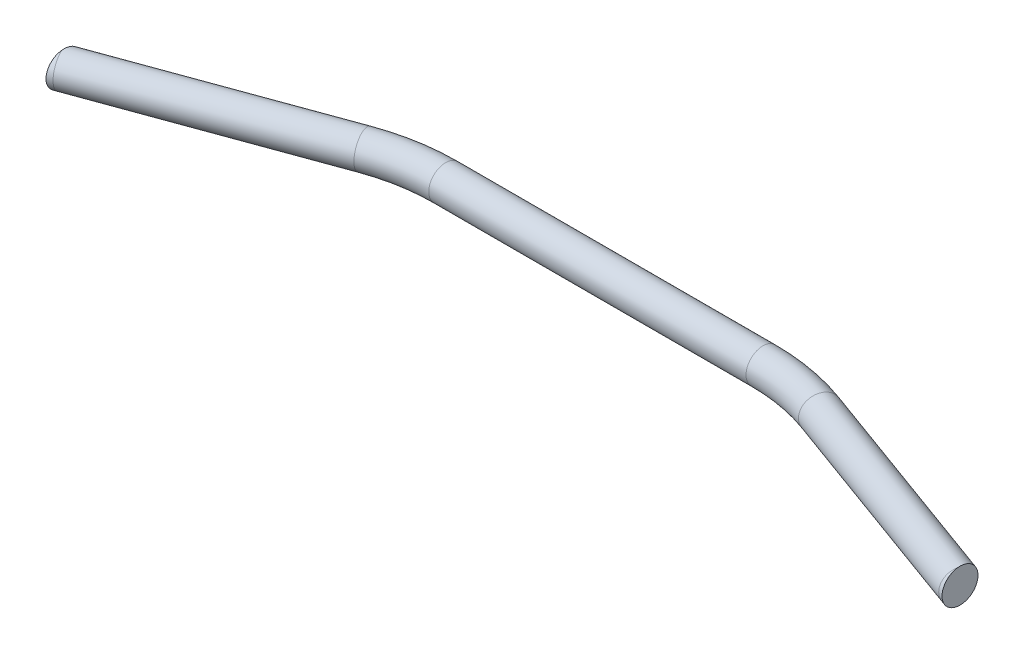
from build123d import *

# Parameters (mm, degrees)
SWEEP1_PROFILE_R     = 6.35
CUT_SWEEP2_START     = 168.275
CUT_SWEEP2_OUTLINE_W = 16
CUT_SWEEP2_OUTLINE_H = 42
CUT_SWEEP2_DEPTH     = 73.999175886


# Read off the part's stored shape, not the designer's step: Cut-Sweep2
with BuildPart() as part:
    # Sweep1: sweep along a path in Sketch1
    with BuildLine(Plane(origin=(0, 0, 0), x_dir=(1, 0, 0), z_dir=(0, 1, 0))) as sweep1_path:
        Line((0, 0), (59.58888407, 0))
        ThreePointArc((59.58888407, 0), (72.820875208, -1.15764922), (85.650818991, -4.595422296))
        Line((85.650818991, -4.595422296), (168.497770272, -34.749246562))
        Line((168.497770272, -34.749246562), (240.102347976, -60.811181483))
    # Sweep1 profile (on start of the path) → Sweep1 (sweep)
    with BuildSketch(Plane(origin=(0, 0, 0), x_dir=(0, 0, 1), z_dir=(1, 0, 0))):
        Circle(SWEEP1_PROFILE_R)
    sweep1 = sweep(path=sweep1_path.line)

    # Cut-Sweep2 outline → Cut-Sweep2 (cut)
    with BuildSketch(Plane.YZ.offset(CUT_SWEEP2_START)):
        with Locations((0, 47)):
            Rectangle(CUT_SWEEP2_OUTLINE_W, CUT_SWEEP2_OUTLINE_H)
    cut_sweep2 = extrude(amount=CUT_SWEEP2_DEPTH, mode=Mode.SUBTRACT)

    # Mirror1: Sweep1, Cut-Sweep2 across plane
    add(sweep1.mirror(Plane(origin=(0, 0, 0), x_dir=(0, 0, 1), z_dir=(1, 0, 0))))
    add(cut_sweep2.mirror(Plane(origin=(0, 0, 0), x_dir=(0, 0, 1), z_dir=(1, 0, 0))), mode=Mode.SUBTRACT)


solid = part.part
